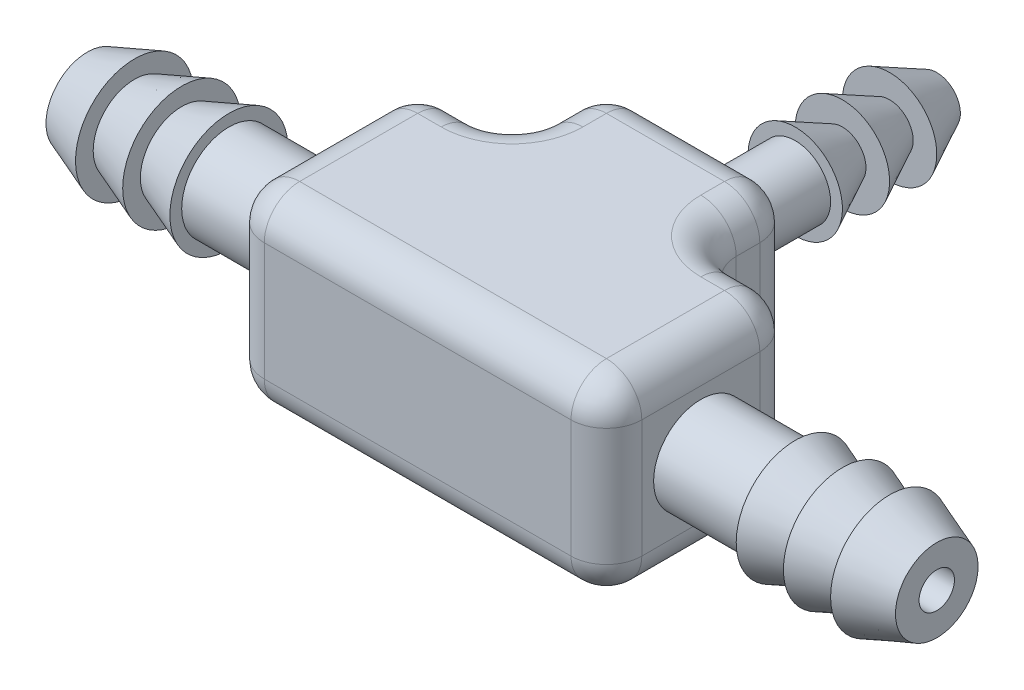
from build123d import *

# Parameters (mm, degrees)
BOSS_EXTRUDE1_DEPTH = 4
FILLET1_R           = 1.5
SHELL1_T            = 1
SKETCH2_R           = 2
BOSS_EXTRUDE2_DEPTH = 4
CUT_EXTRUDE1_REACH  = 23.909
SKETCH4_R           = 0.75
SKETCH5_R           = 1.5
BOSS_EXTRUDE3_DEPTH = 4
CUT_EXTRUDE2_REACH  = 26.413
SKETCH6_R           = 0.5


with BuildPart() as part:
    # Sketch1 → Boss-Extrude1 (new, symmetric)
    with BuildSketch(Plane(origin=(0, 0, 0), x_dir=(1, 0, 0), z_dir=(0, 1, 0))):
        with BuildLine():
            Line((-6.5, -4), (6.5, -4))
            ThreePointArc((6.5, -4), (7.560660172, -3.560660172), (8, -2.5))
            Line((8, -2.5), (8, 2.5))
            ThreePointArc((8, 2.5), (7.560660172, 3.560660172), (6.5, 4))
            Line((6.5, 4), (5.5, 4))
            ThreePointArc((5.5, 4), (4.439339828, 4.439339828), (4, 5.5))
            Line((4, 5.5), (4, 6.5))
            ThreePointArc((4, 6.5), (3.560660172, 7.560660172), (2.5, 8))
            Line((2.5, 8), (-2.5, 8))
            ThreePointArc((-2.5, 8), (-3.560660172, 7.560660172), (-4, 6.5))
            Line((-4, 6.5), (-4, 5.5))
            ThreePointArc((-4, 5.5), (-4.439339828, 4.439339828), (-5.5, 4))
            Line((-5.5, 4), (-6.5, 4))
            ThreePointArc((-6.5, 4), (-7.560660172, 3.560660172), (-8, 2.5))
            Line((-8, 2.5), (-8, -2.5))
            ThreePointArc((-8, -2.5), (-7.560660172, -3.560660172), (-6.5, -4))
        make_face()
    extrude(amount=BOSS_EXTRUDE1_DEPTH, both=True)

    # Fillet1
    fillet1_edges = [part.edges().sort_by_distance(p)[0] for p in [
        (-7.560660172, -4, 3.560660172),
        (-8, -4, 0),
        (-7.560660172, -4, -3.560660172),
        (-6, -4, -4),
        (-4.439339828, -4, -4.439339828),
        (-4, -4, -6),
        (-3.560660172, -4, -7.560660172),
        (0, -4, -8),
        (3.560660172, -4, -7.560660172),
        (4, -4, -6),
        (4.439339828, -4, -4.439339828),
        (6, -4, -4),
        (7.560660172, -4, -3.560660172),
        (8, -4, 0),
        (7.560660172, -4, 3.560660172),
        (-7.560660172, 4, 3.560660172),
        (-8, 4, 0),
        (-7.560660172, 4, -3.560660172),
        (-6, 4, -4),
        (-4.439339828, 4, -4.439339828),
        (-4, 4, -6),
        (-3.560660172, 4, -7.560660172),
        (0, 4, -8),
        (3.560660172, 4, -7.560660172),
        (4, 4, -6),
        (4.439339828, 4, -4.439339828),
        (6, 4, -4),
        (7.560660172, 4, -3.560660172),
        (8, 4, 0),
        (7.560660172, 4, 3.560660172),
        (0, -4, 4),
        (0, 4, 4),
    ]]
    fillet(fillet1_edges, radius=FILLET1_R)

    # Shell1 (no face opened: a closed hollow body)
    add(offset(amount=-SHELL1_T, mode=Mode.PRIVATE), mode=Mode.SUBTRACT)

    # Sketch2 → Boss-Extrude2 (add)
    with BuildSketch(Plane.ZY.offset(8)):
        Circle(SKETCH2_R)
    boss_extrude2 = extrude(amount=BOSS_EXTRUDE2_DEPTH)

    # Sketch4 → Cut-Extrude1 (cut, up to next)
    with BuildSketch(Plane.ZY.offset(12), mode=Mode.PRIVATE) as cut_extrude1_sk1:
        Circle(SKETCH4_R)
    cut_extrude1_tool1 = extrude(cut_extrude1_sk1.sketch, amount=-CUT_EXTRUDE1_REACH, mode=Mode.PRIVATE) & part.part
    cut_extrude1 = cut_extrude1_tool1.solids().sort_by_distance((-12, 0, 0))[0]
    add(cut_extrude1, mode=Mode.SUBTRACT)

    # Sketch3 → Revolve1 (revolve)
    with BuildSketch(Plane(origin=(0, 0, 0), x_dir=(1, 0, 0), z_dir=(0, 1, 0))):
        Polygon((-12, 0.75), (-18, 0.75), (-18, 1.75), (-16, 2.5), (-16, 1.75), (-14, 2.5), (-14, 1.75), (-12, 2.5), align=None)
    revolve1 = revolve(axis=Axis((-12, 0, 0), (1, 0, 0)))

    # Mirror1: Boss-Extrude2, Cut-Extrude1, Revolve1 across plane
    add(boss_extrude2.mirror(Plane(origin=(0, 0, 0), x_dir=(0, 0, 1), z_dir=(1, 0, 0))))
    add(cut_extrude1.mirror(Plane(origin=(0, 0, 0), x_dir=(0, 0, 1), z_dir=(1, 0, 0))), mode=Mode.SUBTRACT)
    add(revolve1.mirror(Plane(origin=(0, 0, 0), x_dir=(0, 0, 1), z_dir=(1, 0, 0))))

    # Sketch5 → Boss-Extrude3 (add)
    with BuildSketch(Plane(origin=(0, 0, -8), x_dir=(-1, 0, 0), z_dir=(0, 0, -1))):
        Circle(SKETCH5_R)
    extrude(amount=BOSS_EXTRUDE3_DEPTH)

    # Sketch6 → Cut-Extrude2 (cut, up to next)
    with BuildSketch(Plane(origin=(0, 0, -12), x_dir=(-1, 0, 0), z_dir=(0, 0, -1)), mode=Mode.PRIVATE) as cut_extrude2_sk1:
        Circle(SKETCH6_R)
    cut_extrude2_tool1 = extrude(cut_extrude2_sk1.sketch, amount=-CUT_EXTRUDE2_REACH, mode=Mode.PRIVATE) & part.part
    add(cut_extrude2_tool1.solids().sort_by_distance((0, 0, -12))[0], mode=Mode.SUBTRACT)

    # Sketch7 → Revolve2 (revolve)
    with BuildSketch(Plane(origin=(0, 0, 0), x_dir=(1, 0, 0), z_dir=(0, 1, 0))):
        Polygon((0.5, 12), (2, 12), (1, 14), (2, 14), (1, 16), (2, 16), (1, 18), (0.5, 18), align=None)
    revolve(axis=Axis((0, 0, -12), (0, 0, 1)))


solid = part.part
